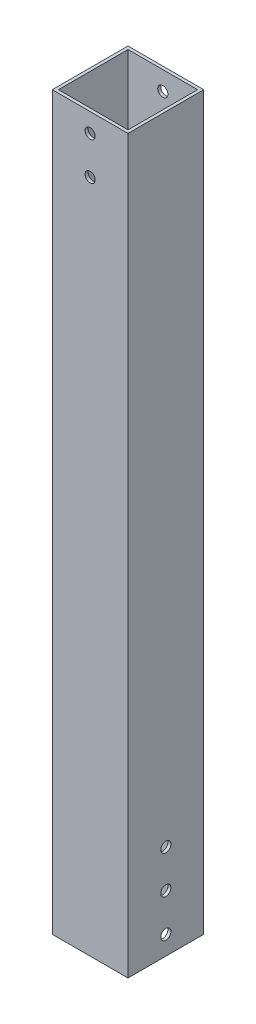
from build123d import *

# Parameters (mm, degrees)
SKETCH1_W              = 38.1
SKETCH1_H              = 38.1
SKETCH1_W_2            = 35.052
SKETCH1_H_2            = 35.052
EXTRUDE_THIN1_DEPTH    = 368.3
F_10_CLEARANCE_HOLE1_D = 5.1054
F_10_CLEARANCE_HOLE2_D = 5.1054


with BuildPart() as part:
    # Sketch1 → Extrude-Thin1 (new body)
    with BuildSketch(Plane(origin=(0, 0, 0), x_dir=(1, 0, 0), z_dir=(0, 1, 0))):
        Rectangle(SKETCH1_W, SKETCH1_H)
        Rectangle(SKETCH1_W_2, SKETCH1_H_2, mode=Mode.SUBTRACT)
    extrude(amount=EXTRUDE_THIN1_DEPTH)

    # #10 Clearance Hole1 (through all)
    with Locations(Plane(origin=(19.05, 0, 0), x_dir=(0, 0, -1), z_dir=(1, 0, 0))):
        with Locations((0, 9.525), (0, 28.575), (0, 47.625)):
            Hole(F_10_CLEARANCE_HOLE1_D / 2)

    # #10 Clearance Hole2 (through all)
    with Locations(Plane.XY.offset(19.05)):
        with Locations((0, 339.725), (0, 358.775)):
            Hole(F_10_CLEARANCE_HOLE2_D / 2)


solid = part.part
